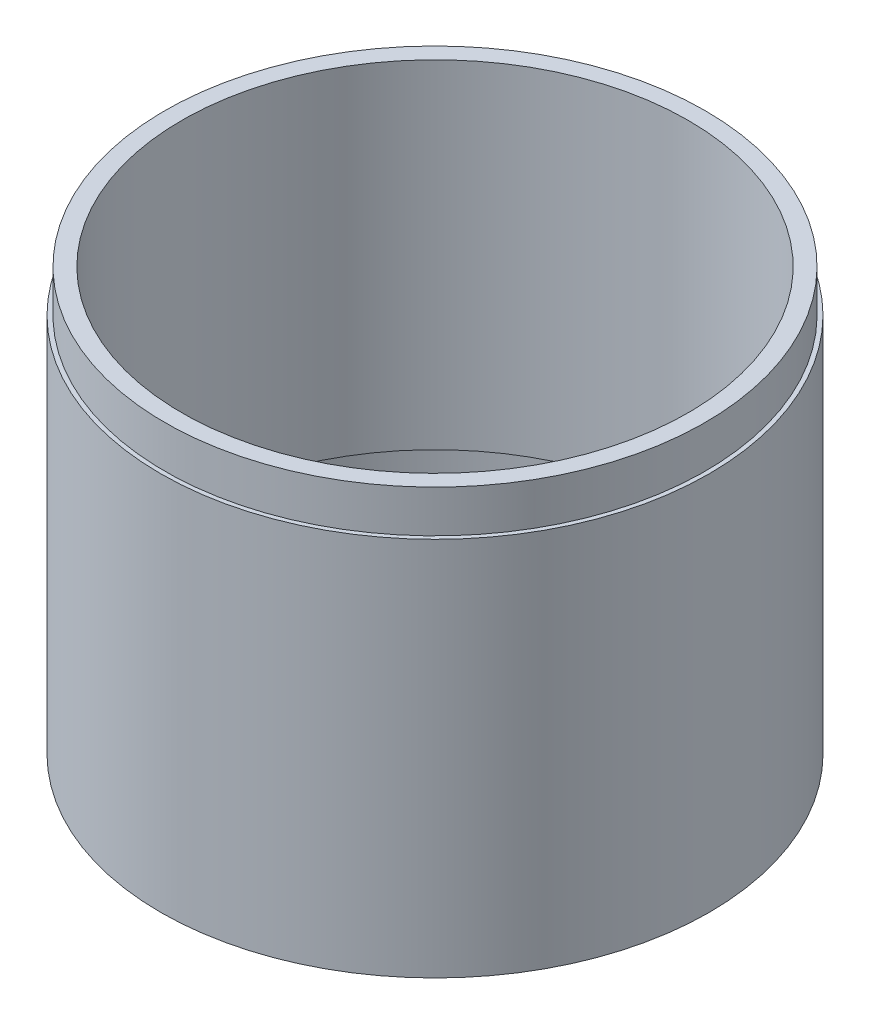
from build123d import *


with BuildPart() as part:
    # Szkic1 → Obrót1 (revolve)
    with BuildSketch(Plane.XY):
        Polygon((-65, 0), (-62, 0), (-62, 20), (-60, 20), (-60, 100), (-64, 100), (-64, 90), (-65, 90), (-65, 20), align=None)
    revolve(axis=Axis((0, 0, 0), (0, 1, 0)))


solid = part.part
